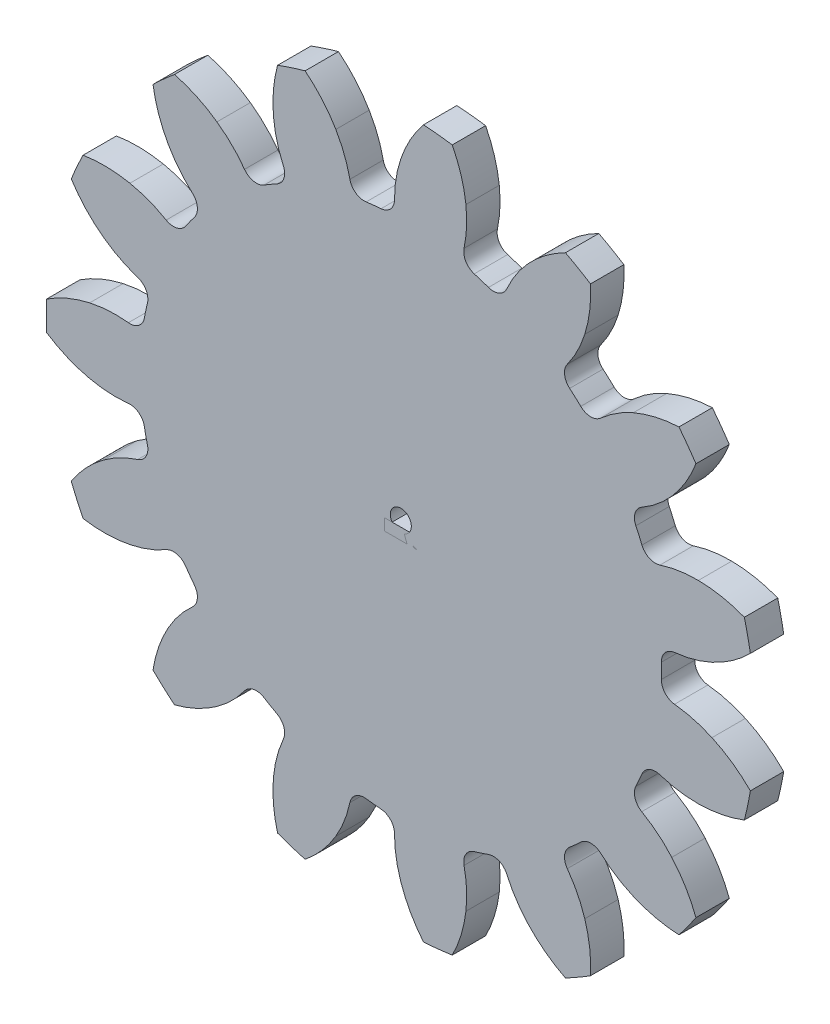
from build123d import *

# Parameters (mm, degrees)
SKETCH1_R           = 26.9875
GEAR_BASE_DEPTH     = 1.27
GEAR_CUT_DEPTH      = 39.250515193
GEAR_TEETH_COUNT    = 15
SKETCH3_R           = 0.8001
BORE_DEPTH          = 39.211660051
SKETCH5_W           = 2.446906476
SKETCH5_H           = 0.878875511
BOSS_EXTRUDE1_DEPTH = 2.54


with BuildPart() as part:
    # Sketch1 → GEAR_BASE (new, symmetric)
    with BuildSketch(Plane.XY):
        Circle(SKETCH1_R)
    extrude(amount=GEAR_BASE_DEPTH, both=True)

    # Sketch2 → GEAR_CUT (cut, through all)
    with BuildSketch(Plane.XY.offset(1.27)):
        with BuildLine():
            ThreePointArc((-25.081599898, -9.961852378), (-26.397758375, -5.611016756), (-26.965032052, -1.101000756))
            ThreePointArc((-26.965032052, -1.101000756), (-25.386045792, -1.945419828), (-23.681539378, -2.4939625))
            ThreePointArc((-23.681539378, -2.4939625), (-22.214193273, -2.699568669), (-20.732987425, -2.662049009))
            ThreePointArc((-20.732987425, -2.662049009), (-19.948924355, -2.876360551), (-19.520504813, -3.567114509))
            ThreePointArc((-19.520504813, -3.567114509), (-19.410116452, -4.125747615), (-19.283744683, -4.680983342))
            ThreePointArc((-19.283744683, -4.680983342), (-19.394170464, -5.486272409), (-20.023279363, -6.000962926))
            ThreePointArc((-20.023279363, -6.000962926), (-21.391688858, -6.569147705), (-22.648548664, -7.353801716))
            ThreePointArc((-22.648548664, -7.353801716), (-23.982580351, -8.5482056), (-25.081599898, -9.961852378))
        make_face()
    gear_cut = extrude(amount=-GEAR_CUT_DEPTH, mode=Mode.SUBTRACT)

    # GEAR_TEETH: GEAR_CUT ×15 about axis
    gear_teeth_axis = Axis((0, 0, 0), (0, 0, 1))
    for i in range(1, GEAR_TEETH_COUNT):
        add(gear_cut.rotate(gear_teeth_axis, i * 360 / GEAR_TEETH_COUNT), mode=Mode.SUBTRACT)

    # Sketch3 → BORE (cut, through all)
    with BuildSketch(Plane.XY.offset(1.27)):
        Circle(SKETCH3_R)
    extrude(amount=-BORE_DEPTH, mode=Mode.SUBTRACT)


with BuildPart() as body_2:
    # Sketch5 → Boss-Extrude1 (new body)
    with BuildSketch(Plane.XY.offset(1.27)):
        with Locations((-0.008897595, -0.536157346)):
            Rectangle(SKETCH5_W, SKETCH5_H)
    extrude(amount=BOSS_EXTRUDE1_DEPTH)


with BuildPart() as body_2_1:
    # Body-Move/Copy1: read off the stored shape, not the designer's step
    # Body-Move/Copy1: moved
    add(body_2.part.moved(Location((0, 0, -2.54))))


with BuildPart() as body_2_2:
    # Body-Move/Copy2: moved
    add(body_2_1.part.moved(Location((0, -0.351602233, 0))))


solid = Compound([part.part, body_2_2.part])
